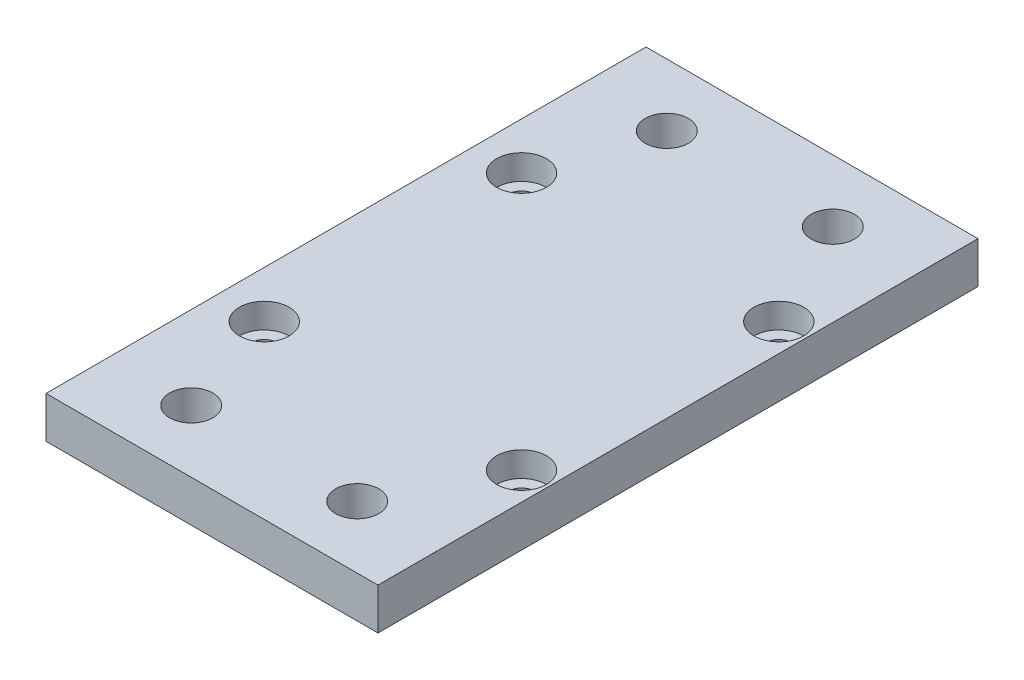
from build123d import *

# Parameters (mm, degrees)
SKETCH2_W           = 42.3
SKETCH2_H           = 72.3
SKETCH2_R           = 1.6
SKETCH2_R_2         = 2.6
BOSS_EXTRUDE1_DEPTH = 5
SKETCH3_R           = 3
CUT_EXTRUDE1_DEPTH  = 3
SKETCH5_W           = 2.3
SKETCH5_H           = 72.3
CUT_EXTRUDE2_DEPTH  = 43.179912281


with BuildPart() as part:
    # Sketch2 → Boss-Extrude1 (new body)
    with BuildSketch(Plane(origin=(0, 0, 0), x_dir=(1, 0, 0), z_dir=(0, 1, 0))):
        Rectangle(SKETCH2_W, SKETCH2_H)
        with Locations((-15.5, -15.5)):
            Circle(SKETCH2_R, mode=Mode.SUBTRACT)
        with Locations((15.5, -15.5)):
            Circle(SKETCH2_R, mode=Mode.SUBTRACT)
        with Locations((-15.5, 15.5)):
            Circle(SKETCH2_R, mode=Mode.SUBTRACT)
        with Locations((15.5, 15.5)):
            Circle(SKETCH2_R, mode=Mode.SUBTRACT)
        with Locations((8.85, 28.65)):
            Circle(SKETCH2_R_2, mode=Mode.SUBTRACT)
        with Locations((-11.15, 28.65)):
            Circle(SKETCH2_R_2, mode=Mode.SUBTRACT)
        with Locations((8.85, -28.65)):
            Circle(SKETCH2_R_2, mode=Mode.SUBTRACT)
        with Locations((-11.15, -28.65)):
            Circle(SKETCH2_R_2, mode=Mode.SUBTRACT)
    extrude(amount=BOSS_EXTRUDE1_DEPTH)

    # Sketch3 → Cut-Extrude1 (cut)
    with BuildSketch(Plane(origin=(0, 5, 0), x_dir=(1, 0, 0), z_dir=(0, 1, 0))):
        with Locations((-15.5, 15.5)):
            Circle(SKETCH3_R)
        with Locations((15.5, 15.5)):
            Circle(SKETCH3_R)
        with Locations((15.5, -15.5)):
            Circle(SKETCH3_R)
        with Locations((-15.5, -15.5)):
            Circle(SKETCH3_R)
    extrude(amount=-CUT_EXTRUDE1_DEPTH, mode=Mode.SUBTRACT)

    # Sketch5 → Cut-Extrude2 (cut, through all)
    with BuildSketch(Plane.XZ):
        with Locations((20, 0)):
            Rectangle(SKETCH5_W, SKETCH5_H)
    extrude(amount=-CUT_EXTRUDE2_DEPTH, mode=Mode.SUBTRACT)


solid = part.part
